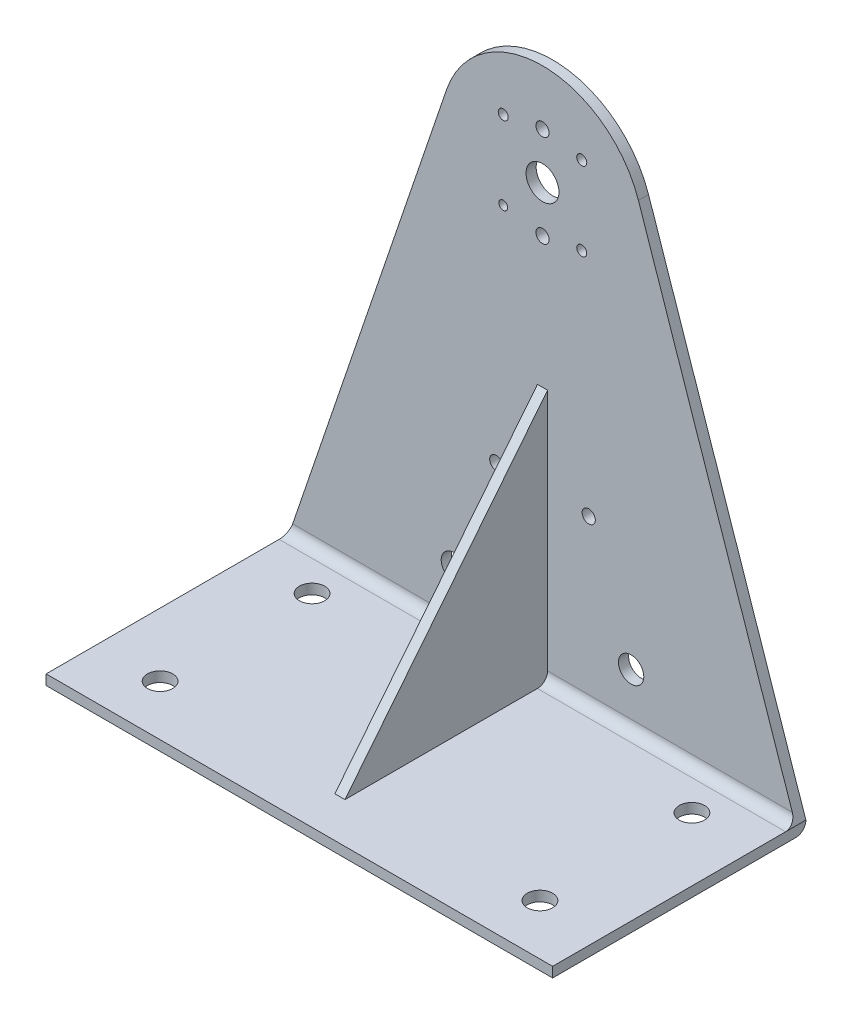
from build123d import *

# Parameters (mm, degrees)
SKETCH1_R           = 6.5
BOSS_EXTRUDE1_DEPTH = 4
SKETCH4_R           = 2.6
CUT_EXTRUDE1_DEPTH  = 10
SKETCH5_W           = 200
SKETCH5_H           = 4
BOSS_EXTRUDE2_DEPTH = 100
FILLET1_R           = 4
RIB5_START          = -2
RIB5_DEPTH          = 4
SKETCH8_R           = 5
CUT_EXTRUDE4_DEPTH  = 100
SKETCH11_R          = 2.6
CUT_EXTRUDE7_DEPTH  = 40
SKETCH9_R           = 5
CUT_EXTRUDE8_DEPTH  = 10
SKETCH12_R          = 1.978720795
SKETCH12_R_2        = 1.75
CUT_EXTRUDE9_DEPTH  = 10


# Read off the part's stored shape, not the designer's step: Rib5
with BuildPart() as part:
    # Sketch1 → Boss-Extrude1 (new body)
    with BuildSketch(Plane.XY):
        with BuildLine():
            Line((100, 0), (37.87398813, 182.867051841))
            ThreePointArc((37.87398813, 182.867051841), (0, 210), (-37.87398813, 182.867051841))
            Line((-37.87398813, 182.867051841), (-100, 0))
            Line((-100, 0), (-100, -4))
            Line((-100, -4), (100, -4))
            Line((100, -4), (100, 0))
        make_face()
        with Locations((0, 170)):
            Circle(SKETCH1_R, mode=Mode.SUBTRACT)
    extrude(amount=BOSS_EXTRUDE1_DEPTH)

    # Sketch4 → Cut-Extrude1 (cut)
    with BuildSketch(Plane(origin=(0, 0, 0), x_dir=(-1, 0, 0), z_dir=(0, 0, -1))):
        with Locations((0, 188.25)):
            Circle(SKETCH4_R)
        with Locations((0, 151.75)):
            Circle(SKETCH4_R)
    extrude(amount=-CUT_EXTRUDE1_DEPTH, mode=Mode.SUBTRACT)

    # Sketch5 → Boss-Extrude2 (add)
    with BuildSketch(Plane(origin=(0, 0, 0), x_dir=(-1, 0, 0), z_dir=(0, 0, -1))):
        with Locations((0, -2)):
            Rectangle(SKETCH5_W, SKETCH5_H)
    extrude(amount=-BOSS_EXTRUDE2_DEPTH)

    # Fillet1
    fillet1_edges = [part.edges().sort_by_distance(p)[0] for p in [
        (0, -4, 0),
        (0, 0, 4),
    ]]
    fillet(fillet1_edges, radius=FILLET1_R)

    # Rib5 outline → Rib5 (add)
    with BuildSketch(Plane.YZ.offset(RIB5_START)):
        with BuildLine():
            Line((4, 4), (100, 4))
            Line((100, 4), (0, 84))
            Line((0, 84), (0, 8))
            ThreePointArc((0, 8), (1.171572875, 5.171572875), (4, 4))
        make_face()
    extrude(amount=RIB5_DEPTH)

    # Sketch8 → Cut-Extrude4 (cut)
    with BuildSketch(Plane(origin=(0, 0, 0), x_dir=(1, 0, 0), z_dir=(0, 1, 0))):
        with Locations(Location((-75, -80, 0), (0, 0, 270))):
            Circle(SKETCH8_R)
        with Locations(Location((-75, -20, 0), (0, 0, 270))):
            Circle(SKETCH8_R)
        with Locations(Location((75, -80, 0), (0, 0, 270))):
            Circle(SKETCH8_R)
        with Locations(Location((75, -20, 0), (0, 0, 270))):
            Circle(SKETCH8_R)
    extrude(amount=-CUT_EXTRUDE4_DEPTH, mode=Mode.SUBTRACT)

    # Sketch11 → Cut-Extrude7 (cut)
    with BuildSketch(Plane(origin=(0, 0, 0), x_dir=(-1, 0, 0), z_dir=(0, 0, -1))):
        with Locations((-18.25, 65)):
            Circle(SKETCH11_R)
        with Locations((18.25, 65)):
            Circle(SKETCH11_R)
    extrude(amount=-CUT_EXTRUDE7_DEPTH, mode=Mode.SUBTRACT)

    # Sketch9 → Cut-Extrude8 (cut)
    with BuildSketch(Plane.XY.offset(4)):
        with Locations((-35, 21)):
            Circle(SKETCH9_R)
        with Locations((35, 21)):
            Circle(SKETCH9_R)
    extrude(amount=-CUT_EXTRUDE8_DEPTH, mode=Mode.SUBTRACT)

    # Sketch12 → Cut-Extrude9 (cut)
    with BuildSketch(Plane.XY.offset(4)):
        with Locations((-15.5, 185.5)):
            Circle(SKETCH12_R)
        with Locations((15.5, 185.5)):
            Circle(SKETCH12_R)
        with Locations((15.5, 154.5)):
            Circle(SKETCH12_R)
        with Locations((-15.5, 154.5)):
            Circle(SKETCH12_R_2)
    extrude(amount=-CUT_EXTRUDE9_DEPTH, mode=Mode.SUBTRACT)


solid = part.part
